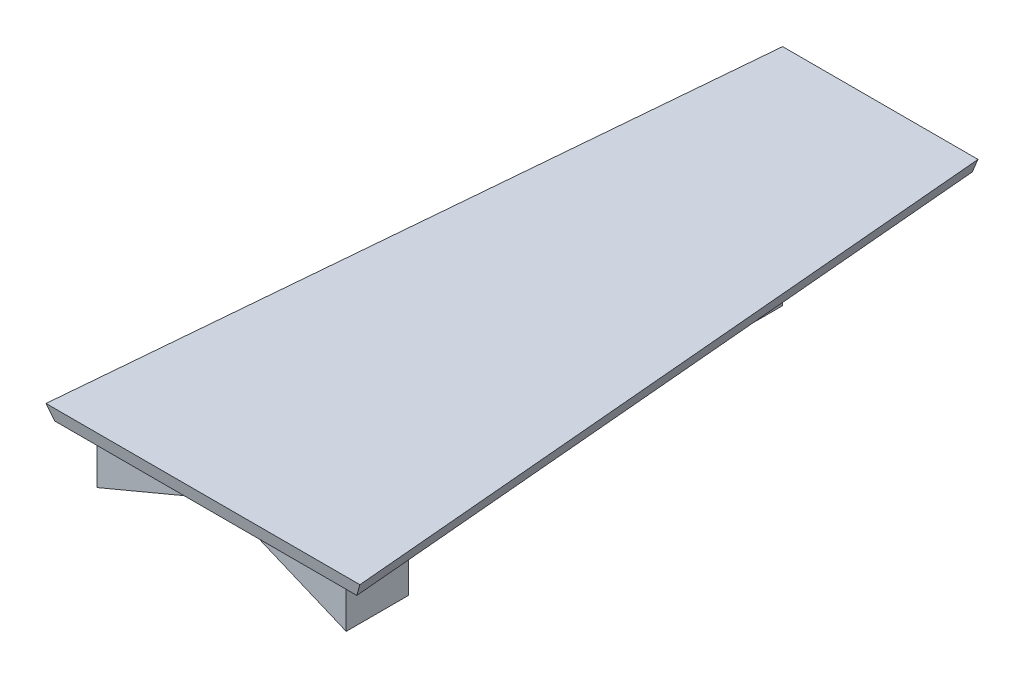
from build123d import *

# Parameters (mm, degrees)
SKIZZE1_W                            = 57
SKIZZE1_H                            = 123
AUFSATZ_LINEAR_AUSTRAGEN1_DEPTH      = 2.5
SCHNITT_LINEAR_AUSTRAGEN1_DEPTH      = 84.889808678
SCHNITT_LINEAR_AUSTRAGEN2_DEPTH      = 68.828828679
SCHNITT_LINEAR_AUSTRAGEN3_DEPTH      = 70.726045338
SCHNITT_LINEAR_AUSTRAGEN3_DEPTH_BACK = 70.726045338
SCHNITT_LINEAR_AUSTRAGEN4_DEPTH      = 70.47454308
SCHNITT_LINEAR_AUSTRAGEN4_DEPTH_BACK = 70.47454308
SKIZZE9_W                            = 45.241474544
SKIZZE9_H                            = 11.280630507
AUFSATZ_LINEAR_AUSTRAGEN2_DEPTH      = 13
SCHNITT_LINEAR_AUSTRAGEN5_DEPTH      = 20
SKIZZE12_W                           = 36.023643564
SKIZZE12_H                           = 10.472363364
AUFSATZ_LINEAR_AUSTRAGEN3_DEPTH      = 5
SCHNITT_LINEAR_AUSTRAGEN6_DEPTH      = 12
SCHNITT_LINEAR_AUSTRAGEN8_DEPTH      = 0.5
SCHNITT_LINEAR_AUSTRAGEN8_DEPTH_BACK = 1.65
SKIZZE16_R                           = 3.1
SCHNITT_LINEAR_AUSTRAGEN9_DEPTH      = 1.15
SCHNITT_LINEAR_AUSTRAGEN9_DEPTH_BACK = 1
SKIZZE17_R                           = 3.1


with BuildPart() as part:
    # Skizze1 → Aufsatz-Linear austragen1 (new body)
    with BuildSketch(Plane(origin=(0, 0, 0), x_dir=(1, 0, 0), z_dir=(0, 1, 0))):
        Rectangle(SKIZZE1_W, SKIZZE1_H)
    extrude(amount=AUFSATZ_LINEAR_AUSTRAGEN1_DEPTH)

    # Skizze2 → Schnitt-Linear austragen1 (cut, through all)
    with BuildSketch(Plane(origin=(28.5, 0, 0), x_dir=(0, 0, -1), z_dir=(1, 0, 0))):
        Polygon((-61.5, 2.5), (-61.5, 0), (-60.968608596, 0), align=None)
    extrude(amount=-SCHNITT_LINEAR_AUSTRAGEN1_DEPTH, mode=Mode.SUBTRACT)

    # Skizze3 → Schnitt-Linear austragen2 (cut, through all)
    with BuildSketch(Plane(origin=(0, 2.5, 0), x_dir=(1, 0, 0), z_dir=(0, 1, 0))):
        Polygon((-28.5, -61.5), (-17.738894386, 61.5), (-28.5, 61.5), align=None)
        Polygon((28.5, -61.5), (17.738894386, 61.5), (28.5, 61.5), align=None)
    extrude(amount=-SCHNITT_LINEAR_AUSTRAGEN2_DEPTH, mode=Mode.SUBTRACT)

    # Skizze5 → Schnitt-Linear austragen3 (cut, two sides: drawn at the far end of the back side and taken through both)
    with BuildSketch(Plane(origin=(0.175618176, 0, 2.007324937), x_dir=(0, -1, 0), z_dir=(0.08715574274765484, 0, 0.9961946980917459)).offset(-SCHNITT_LINEAR_AUSTRAGEN3_DEPTH_BACK)):
        Polygon((0.008562414, 23.031470717), (-2.5, 23.031470717), (0, 21.995936811), align=None)
    extrude(amount=SCHNITT_LINEAR_AUSTRAGEN3_DEPTH + SCHNITT_LINEAR_AUSTRAGEN3_DEPTH_BACK, mode=Mode.SUBTRACT)

    # Skizze6 → Schnitt-Linear austragen4 (cut, two sides: drawn at the far end of the back side and taken through both)
    with BuildSketch(Plane(origin=(-0.152372814, 0, 1.741629235), x_dir=(0, 1, 0), z_dir=(-0.08715574274766175, 0, 0.9961946980917452)).offset(-SCHNITT_LINEAR_AUSTRAGEN4_DEPTH_BACK)):
        Polygon((2.5, 23.031470717), (0, 21.995936811), (0, 23.031470717), align=None)
    extrude(amount=SCHNITT_LINEAR_AUSTRAGEN4_DEPTH + SCHNITT_LINEAR_AUSTRAGEN4_DEPTH_BACK, mode=Mode.SUBTRACT)

    # Skizze9 → Aufsatz-Linear austragen2 (add)
    with BuildSketch(Plane.XZ):
        with Locations((0, 52.468608596)):
            Rectangle(SKIZZE9_W, SKIZZE9_H)
    extrude(amount=AUFSATZ_LINEAR_AUSTRAGEN2_DEPTH)

    # Skizze11 → Schnitt-Linear austragen5 (cut)
    with BuildSketch(Plane(origin=(0, 0, 46.828293342), x_dir=(-1, 0, 0), z_dir=(0, 0, -1))):
        Polygon((-22.620737272, -9.484039906), (0, 0), (22.620737272, -9.484039906), (22.620737272, -13), (-22.620737272, -13), align=None)
    extrude(amount=-SCHNITT_LINEAR_AUSTRAGEN5_DEPTH, mode=Mode.SUBTRACT)

    # Skizze12 → Aufsatz-Linear austragen3 (add)
    with BuildSketch(Plane.XZ):
        with Locations((0, -20.5)):
            Rectangle(SKIZZE12_W, SKIZZE12_H)
    extrude(amount=AUFSATZ_LINEAR_AUSTRAGEN3_DEPTH)

    # Skizze13 → Schnitt-Linear austragen6 (cut)
    with BuildSketch(Plane(origin=(0, 0, -25.736181682), x_dir=(-1, 0, 0), z_dir=(0, 0, -1))):
        Polygon((-18.011821782, -2.5), (-7.183132097, 0), (7.183132097, 0), (18.011821782, -2.5), (18.011821782, -5), (-18.011821782, -5), align=None)
    extrude(amount=-SCHNITT_LINEAR_AUSTRAGEN6_DEPTH, mode=Mode.SUBTRACT)

    # Skizze16 → Schnitt-Linear austragen8 (cut, two sides: drawn at the far end of the back side and taken through both)
    with BuildSketch(Plane.XZ.offset(-SCHNITT_LINEAR_AUSTRAGEN8_DEPTH_BACK)):
        with Locations((12.59747694, -20.5)):
            Circle(SKIZZE16_R)
        with Locations((-12.59747694, -20.5)):
            Circle(SKIZZE16_R)
    extrude(amount=SCHNITT_LINEAR_AUSTRAGEN8_DEPTH + SCHNITT_LINEAR_AUSTRAGEN8_DEPTH_BACK, mode=Mode.SUBTRACT)

    # Skizze17 → Schnitt-Linear austragen9 (cut, two sides: drawn at the far end of the back side and taken through both)
    with BuildSketch(Plane(origin=(0, -4.742019953, 0), x_dir=(1, 0, 0), z_dir=(0, 1, 0)).offset(-SCHNITT_LINEAR_AUSTRAGEN9_DEPTH_BACK)):
        with Locations((-16.965552954, -52.468608596)):
            Circle(SKIZZE17_R)
        with Locations((16.965552954, -52.468608596)):
            Circle(SKIZZE17_R)
    extrude(amount=SCHNITT_LINEAR_AUSTRAGEN9_DEPTH + SCHNITT_LINEAR_AUSTRAGEN9_DEPTH_BACK, mode=Mode.SUBTRACT)


solid = part.part
